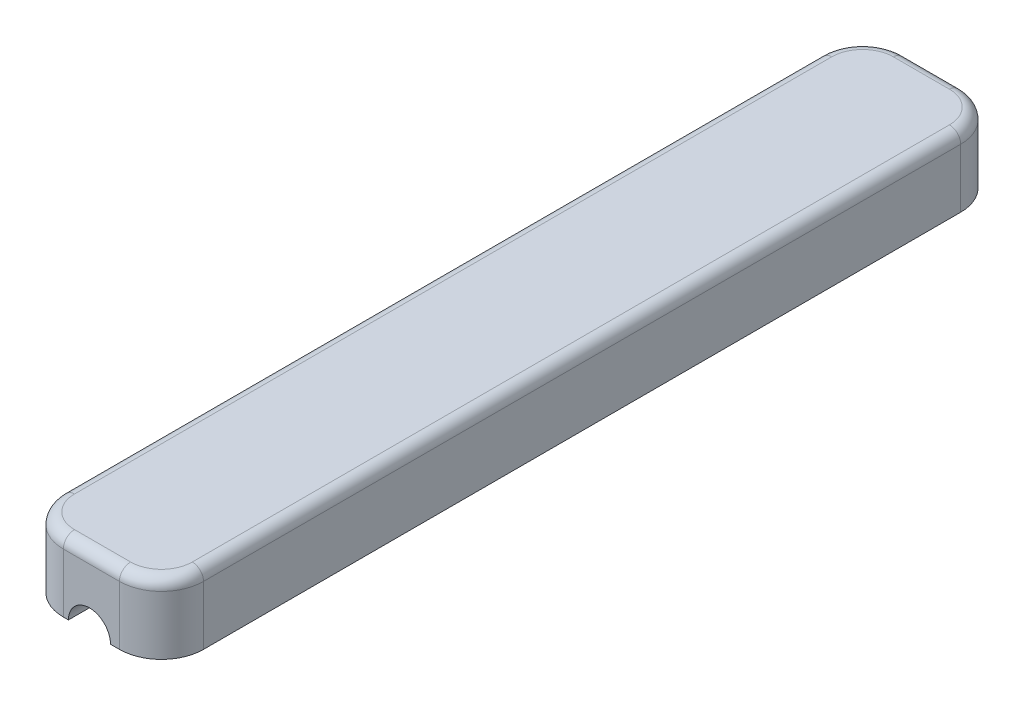
from build123d import *

# Parameters (mm, degrees)
ESBO_O1_W                  = 300
ESBO_O1_H                  = 25
RESSALTO_EXTRUS_O1_DEPTH   = 50
FILETE1_R                  = 4
FILETE2_R                  = 15
CORTE_EXTRUS_O2_DEPTH      = 159.607219382
CORTE_EXTRUS_O2_DEPTH_BACK = 159.607219382
ESBO_O8_R                  = 7.5


with BuildPart() as part:
    # Esboço1 → Ressalto-extrusão1 (new body)
    with BuildSketch(Plane(origin=(0, 0, 0), x_dir=(0, 0, -1), z_dir=(1, 0, 0))):
        Rectangle(ESBO_O1_W, ESBO_O1_H)
    extrude(amount=RESSALTO_EXTRUS_O1_DEPTH)

    # Filete1
    filete1_edges = [part.edges().sort_by_distance(p)[0] for p in [
        (50, 12.5, 0),
        (0, 12.5, 0),
        (25, 12.5, 150),
        (25, 12.5, -150),
    ]]
    fillet(filete1_edges, radius=FILETE1_R)

    # Filete2
    # the kernel refuses this fillet: 15 mm, written as the material it takes off along each edge
    with BuildSketch(Plane(origin=(35, 12.5, 135), x_dir=(0, 0, 1), z_dir=(-1, 0, 0))) as filete2_piece_1:
        with BuildLine():
            CenterArc((11, -4), 4, 0, 90)
            Line((15, -4), (15, 0))
            Line((15, 0), (11, 0))
        make_face()
    revolve(axis=Axis((35, 12.5, 135), (0, 1, 0)), revolution_arc=90, mode=Mode.SUBTRACT)
    with BuildSketch(Plane(origin=(15, 12.5, 135), x_dir=(-1, 0, 0), z_dir=(0, 0, -1))) as filete2_piece_2:
        with BuildLine():
            CenterArc((11, -4), 4, 0, 90)
            Line((15, -4), (15, 0))
            Line((15, 0), (11, 0))
        make_face()
    revolve(axis=Axis((15, 12.5, 135), (0, 1, 0)), revolution_arc=90, mode=Mode.SUBTRACT)
    with BuildSketch(Plane(origin=(35, 12.5, -135), x_dir=(1, 0, 0), z_dir=(0, 0, 1))) as filete2_piece_3:
        with BuildLine():
            CenterArc((11, -4), 4, 0, 90)
            Line((15, -4), (15, 0))
            Line((15, 0), (11, 0))
        make_face()
    revolve(axis=Axis((35, 12.5, -135), (0, 1, 0)), revolution_arc=90, mode=Mode.SUBTRACT)
    with BuildSketch(Plane(origin=(15, 12.5, -135), x_dir=(0, 0, -1), z_dir=(1, 0, 0))) as filete2_piece_4:
        with BuildLine():
            CenterArc((11, -4), 4, 0, 90)
            Line((15, -4), (15, 0))
            Line((15, 0), (11, 0))
        make_face()
    revolve(axis=Axis((15, 12.5, -135), (0, 1, 0)), revolution_arc=90, mode=Mode.SUBTRACT)
    with BuildSketch(Plane(origin=(50, 12.5, 150), x_dir=(0, 0, -1), z_dir=(0, -1, 0)), Plane(origin=(0, -50, -150), x_dir=(1, 0, 0), z_dir=(0, 1, 0))) as filete2_piece_5:
        with BuildLine():
            CenterArc((FILETE2_R, -FILETE2_R), FILETE2_R, 90, 90)
            Line((0, -FILETE2_R), (0, 0))
            Line((0, 0), (FILETE2_R, 0))
        make_face()
    extrude(amount=62.5, mode=Mode.SUBTRACT)
    with BuildSketch(Plane(origin=(0, 12.5, 150), x_dir=(0, 0, -1), z_dir=(0, -1, 0)), Plane(origin=(50, -50, -150), x_dir=(-1, 0, 0), z_dir=(0, 1, 0))) as filete2_piece_6:
        with BuildLine():
            CenterArc((FILETE2_R, FILETE2_R), FILETE2_R, 180, 90)
            Line((0, FILETE2_R), (0, 0))
            Line((0, 0), (FILETE2_R, 0))
        make_face()
    extrude(amount=62.5, mode=Mode.SUBTRACT)

    # Esboço8 → Corte-extrusão2 (cut, two sides: drawn at the far end of the back side and taken through both)
    with BuildSketch(Plane.XY.offset(-CORTE_EXTRUS_O2_DEPTH_BACK)):
        with Locations((24.323943137, -12.5)):
            Circle(ESBO_O8_R)
    extrude(amount=CORTE_EXTRUS_O2_DEPTH + CORTE_EXTRUS_O2_DEPTH_BACK, mode=Mode.SUBTRACT)


solid = part.part
